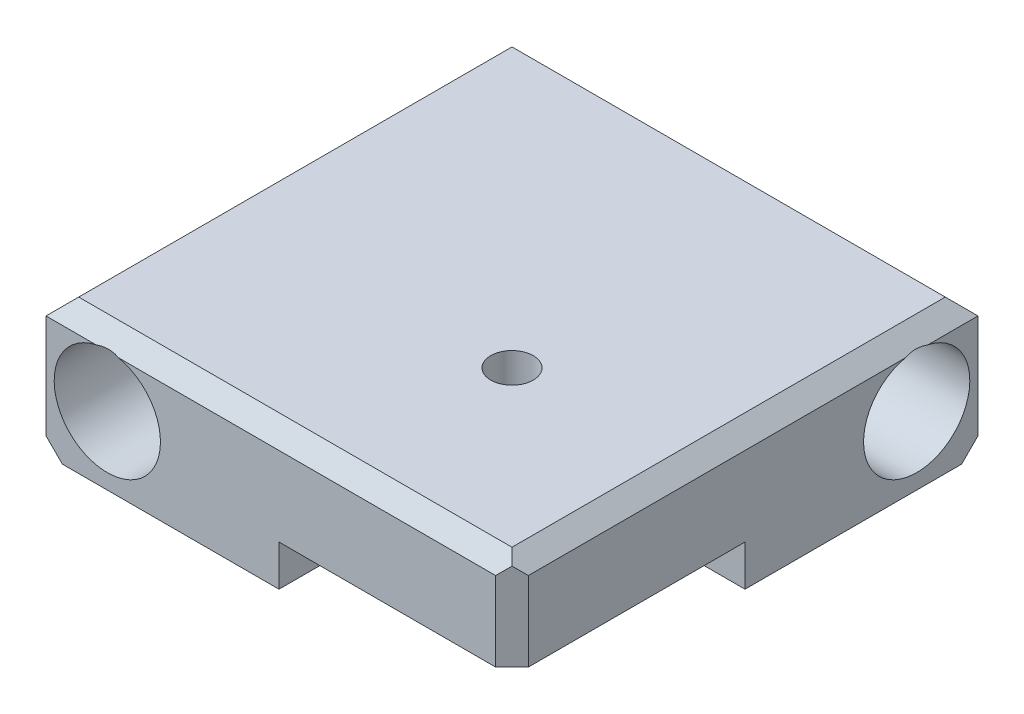
from build123d import *

# Parameters (mm, degrees)
SKETCH1_W           = 15
SKETCH1_H           = 10
SKETCH1_H_2         = 15
SKETCH1_W_2         = 10
BOSS_EXTRUDE1_DEPTH = 16.7
SKETCH2_R           = 6.5
CUT_EXTRUDE1_DEPTH  = 8.3
SKETCH3_R           = 6.5
CUT_EXTRUDE2_DEPTH  = 8.3
SKETCH4_R           = 6.5
CUT_EXTRUDE3_DEPTH  = 14.7
SKETCH5_W           = 42
SKETCH5_H           = 42
SKETCH5_R           = 2.6
BOSS_EXTRUDE3_DEPTH = 16.7
FILLET9_SIZE        = 2
BOSS_EXTRUDE4_START = 32
SKETCH7_R           = 6.5
BOSS_EXTRUDE4_DEPTH = 32
BOSS_EXTRUDE5_START = 32
SKETCH8_R           = 6.5
BOSS_EXTRUDE5_DEPTH = 32
CUT_EXTRUDE4_DEPTH  = 5
CHAMFER1_SIZE       = 2


with BuildPart() as part:
    # Sketch1 → Boss-Extrude1 (new body)
    with BuildSketch(Plane(origin=(0, 0, 0), x_dir=(1, 0, 0), z_dir=(0, 1, 0))):
        Rectangle(SKETCH1_W, SKETCH1_H)
        with Locations((0, 12.5)):
            Rectangle(SKETCH1_W, SKETCH1_H_2)
        with Locations((12.5, 12.5)):
            Rectangle(SKETCH1_W_2, SKETCH1_H_2)
    extrude(amount=BOSS_EXTRUDE1_DEPTH)

    # Sketch2 → Cut-Extrude1 (cut)
    with BuildSketch(Plane.XY.offset(5)):
        with Locations((0, 8.35)):
            Circle(SKETCH2_R)
    extrude(amount=-CUT_EXTRUDE1_DEPTH, mode=Mode.SUBTRACT)

    # Sketch3 → Cut-Extrude2 (cut)
    with BuildSketch(Plane(origin=(17.5, 0, 0), x_dir=(0, 0, -1), z_dir=(1, 0, 0))):
        with Locations((12.5, 8.35)):
            Circle(SKETCH3_R)
    extrude(amount=-CUT_EXTRUDE2_DEPTH, mode=Mode.SUBTRACT)

    # Sketch4 → Cut-Extrude3 (cut)
    with BuildSketch(Plane.XZ):
        with Locations(Location((0, -12.5, 0), (0, 0, 270))):
            Circle(SKETCH4_R)
    extrude(amount=-CUT_EXTRUDE3_DEPTH, mode=Mode.SUBTRACT)

    # Fillet8
    # the kernel refuses this chamfer: 2 mm, written as the material it takes off along each edge
    with BuildSketch(Plane(origin=(-6.166666667, 1.333333333, -18.666666667), x_dir=(0.7071067811865471, 0, -0.707106781186548), z_dir=(-0.5773502691896263, -0.5773502691896255, -0.5773502691896254)), Plane(origin=(-6.166666667, 15.366666667, -18.666666667), x_dir=(0.7071067811865471, 0.7071067811865478, 0), z_dir=(-0.5773502691896261, 0.5773502691896256, -0.5773502691896256))) as fillet8_piece_1:
        Polygon((-1.414213562, -0.816496581), (1.414213562, -0.816496581), (0, 1.632993162), align=None)
    extrude(amount=2.540341184, mode=Mode.SUBTRACT)
    with BuildSketch(Plane(origin=(-7.5, 0, -25.143365976), x_dir=(-0.027495876610586494, 0.9996219169112968, 0), z_dir=(0, 0, 1)), Plane(origin=(22.643365976, 16.7, -20), x_dir=(0, 0.027495876610585647, 0.9996219169112968), z_dir=(-1, 0, 0)), Plane(origin=(-7.5, 16.7, 10.143365976), x_dir=(-0.027495876610586487, -0.9996219169112968, 0), z_dir=(0, 0, -1)), Plane(origin=(22.643365976, 0, -20), x_dir=(0, 0.9996219169112968, -0.02749587661058563), z_dir=(-1, 0, 0))) as fillet8_piece_2:
        with BuildLine():
            Line((2.05734639, 0), (-0.11309431, -2.054235587))
            Line((-0.11309431, -2.054235587), (-0.153079186, -2.053135752))
            ThreePointArc((-0.153079186, -2.053135752), (-0.068258454, -1.026795659), (-0.039984877, 0.001099835))
            Line((-0.039984877, 0.001099835), (0.001099835, 0.039984877))
            ThreePointArc((0.001099835, 0.039984877), (1.028995329, 0.011711299), (2.058446225, 0.039984877))
            Line((2.058446225, 0.039984877), (2.05734639, 0))
        make_face()
    extrude(amount=35.286731952, mode=Mode.SUBTRACT)
    with BuildSketch(Plane(origin=(-7.5, -5.143365976, -20), x_dir=(-0.02749587661058694, 0, 0.9996219169112968), z_dir=(0, 1, 0))) as fillet8_piece_3:
        with BuildLine():
            Line((2.05734639, 0), (-0.11309431, 2.054235587))
            Line((-0.11309431, 2.054235587), (-0.153079186, 2.053135752))
            ThreePointArc((-0.153079186, 2.053135752), (-0.068258454, 1.026795659), (-0.039984877, -0.001099835))
            Line((-0.039984877, -0.001099835), (0.001099835, -0.039984877))
            ThreePointArc((0.001099835, -0.039984877), (1.028995329, -0.011711299), (2.058446225, -0.039984877))
            Line((2.058446225, -0.039984877), (2.05734639, 0))
        make_face()
    extrude(amount=26.986731952, mode=Mode.SUBTRACT)

    # Sketch5 → Boss-Extrude3 (add)
    with BuildSketch(Plane(origin=(0, 16.7, 0), x_dir=(1, 0, 0), z_dir=(0, 1, 0))):
        with Locations((28.5, -16)):
            Rectangle(SKETCH5_W, SKETCH5_H)
        with Locations(Location((28.5, -16, 0), (0, 0, 270))):
            Circle(SKETCH5_R, mode=Mode.SUBTRACT)
    extrude(amount=-BOSS_EXTRUDE3_DEPTH)

    # Fillet9
    fillet9_edges = [part.edges().sort_by_distance(p)[0] for p in [
        (49.5, 8.35, 37),
    ]]
    chamfer(fillet9_edges, length=FILLET9_SIZE)

    # Sketch7 → Boss-Extrude4 (add)
    with BuildSketch(Plane.XY.offset(5).offset(BOSS_EXTRUDE4_START)):
        Polygon((-5.5, 16.7), (-7.5, 14.7), (-7.5, 2), (-5.5, 0), (7.5, 0), (7.5, 16.7), align=None)
        with Locations((0, 8.35)):
            Circle(SKETCH7_R, mode=Mode.SUBTRACT)
    extrude(amount=-BOSS_EXTRUDE4_DEPTH)

    # Sketch8 → Boss-Extrude5 (add)
    with BuildSketch(Plane(origin=(17.5, 0, 0), x_dir=(0, 0, -1), z_dir=(1, 0, 0)).offset(BOSS_EXTRUDE5_START)):
        Polygon((5, 16.7), (5, 0), (18, 0), (20, 2), (20, 14.7), (18, 16.7), align=None)
        with Locations((12.5, 8.35)):
            Circle(SKETCH8_R, mode=Mode.SUBTRACT)
    extrude(amount=-BOSS_EXTRUDE5_DEPTH)

    # Sketch9 → Cut-Extrude4 (cut)
    with BuildSketch(Plane.XZ):
        with BuildLine():
            Line((28.5, 8.5), (49.5, 8.5))
            Line((49.5, 8.5), (49.5, 35))
            Line((49.5, 35), (47.5, 37))
            Line((47.5, 37), (28.5, 37))
            Line((28.5, 37), (21, 37))
            Line((21, 37), (21, 16))
            ThreePointArc((21, 16), (23.196699141, 10.696699141), (28.5, 8.5))
        make_face()
    extrude(amount=-CUT_EXTRUDE4_DEPTH, mode=Mode.SUBTRACT)

    # Chamfer1
    # the kernel refuses this chamfer: 2 mm, written as the material it takes off along each edge
    with BuildSketch(Plane(origin=(49.5, 16.7, 40.143365976), x_dir=(-0.9996219169112968, 0.027495876610585647, 0), z_dir=(0, 0, -1)), Plane(origin=(-10.643365976, 16.7, 37), x_dir=(0, 0.027495876610585647, -0.9996219169112968), z_dir=(1, 0, 0))) as chamfer1_piece_1:
        Polygon((CHAMFER1_SIZE * 0.999621916911, -CHAMFER1_SIZE * 0.0274958766106), (-CHAMFER1_SIZE * 0.0274958766106, -CHAMFER1_SIZE * 0.999621916911), (0, 0), align=None)
    extrude(amount=63.286731952, mode=Mode.SUBTRACT)


solid = part.part
